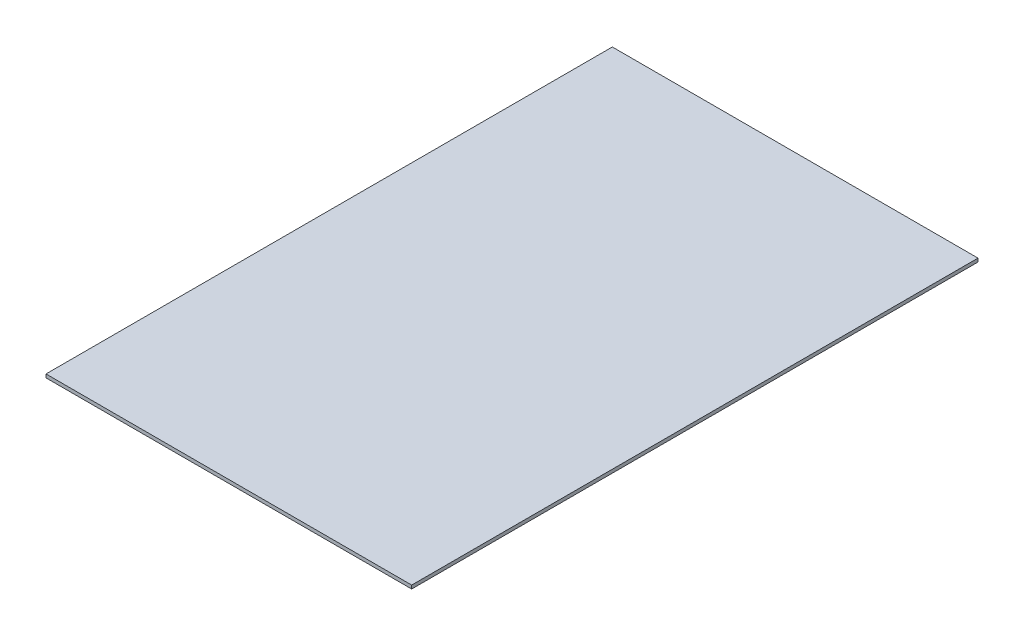
from build123d import *

# Parameters (mm, degrees)
SKETCH_1_W      = 318.56
SKETCH_1_H      = 493.33
EXTRUDE_1_DEPTH = 3


with BuildPart() as part:
    # 草图1 → 凸台-拉伸1 (new body)
    with BuildSketch(Plane(origin=(0, 0, 0), x_dir=(1, 0, 0), z_dir=(0, 1, 0))):
        Rectangle(SKETCH_1_W, SKETCH_1_H)
    extrude(amount=EXTRUDE_1_DEPTH)


solid = part.part
